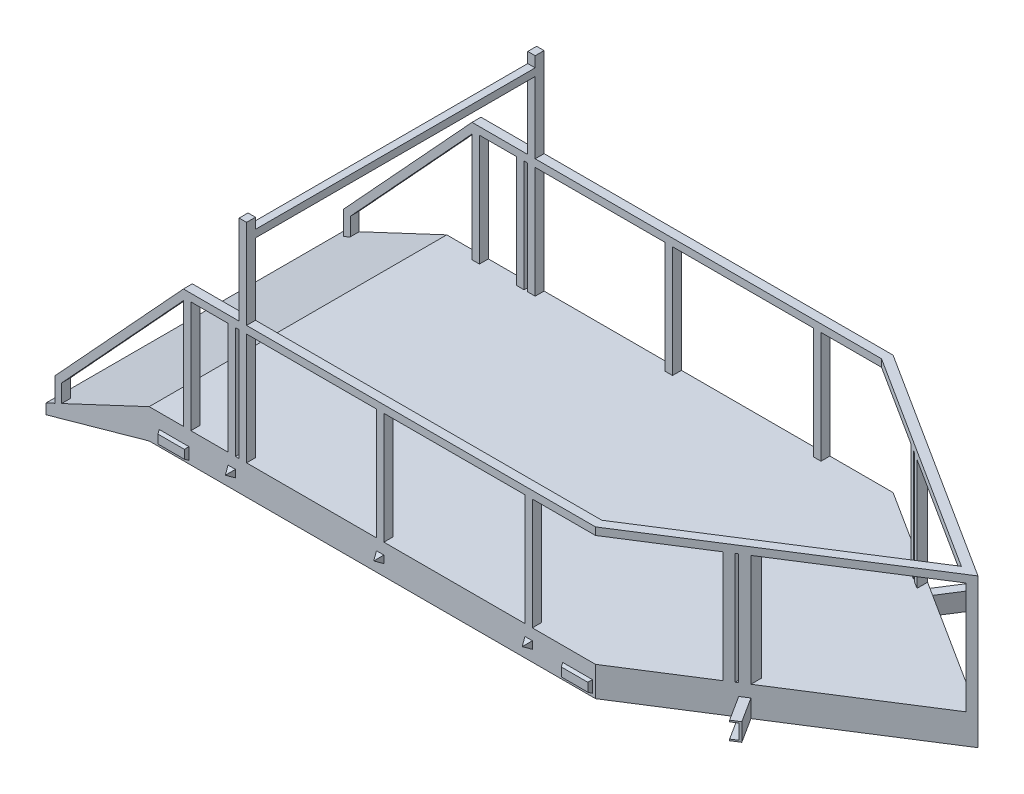
from build123d import *

# Parameters (mm, degrees)
BOSS_EXTRUDE1_DEPTH      = 500
BOSS_EXTRUDE2_DEPTH      = 500
BOSS_EXTRUDE2_DEPTH_BACK = 500
CUT_EXTRUDE1_START       = -500
CUT_EXTRUDE1_OUTLINE_W   = 473.864747831
CUT_EXTRUDE1_OUTLINE_H   = 375
CUT_EXTRUDE1_OUTLINE_W_2 = 7.552750907
CUT_EXTRUDE1_OUTLINE_W_3 = 441.311996924
CUT_EXTRUDE1_OUTLINE_W_4 = 436.609859473
CUT_EXTRUDE1_OUTLINE_W_5 = 473.864747832
CUT_EXTRUDE1_OUTLINE_W_6 = 12.254888358
CUT_EXTRUDE1_OUTLINE_W_7 = 125
CUT_EXTRUDE1_DEPTH       = 1000
BOSS_EXTRUDE3_DEPTH      = 100
CUT_EXTRUDE4_DEPTH       = 470
BOSS_EXTRUDE5_DEPTH      = 500
BOSS_EXTRUDE5_DEPTH_BACK = 500
CUT_EXTRUDE7_DEPTH       = 470
SKETCH10_W               = 1000
SKETCH10_H               = 25
BOSS_EXTRUDE6_DEPTH      = 25
SKETCH11_W               = 25
SKETCH11_H               = 25
SKETCH11_W_2             = 24.921787331
BOSS_EXTRUDE7_DEPTH      = 25
BOSS_EXTRUDE7_TAPER      = 30
BOSS_EXTRUDE8_START      = 525.229495663
BOSS_EXTRUDE8_DEPTH      = 0.022340747
BOSS_EXTRUDE8_START_2    = -485
BOSS_EXTRUDE8_2_DEPTH    = 25
BOSS_EXTRUDE8_START_3    = 13.864747831
BOSS_EXTRUDE8_3_DEPTH    = 25
BOSS_EXTRUDE8_START_4    = 512.729495663
BOSS_EXTRUDE8_4_DEPTH    = 25.022340747
BOSS_EXTRUDE8_START_5    = 37
BOSS_EXTRUDE8_5_DEPTH    = 26
BOSS_EXTRUDE10_DEPTH     = 500
CUT_EXTRUDE8_DEPTH       = 440
CUT_EXTRUDE9_DEPTH       = 23
CUT_EXTRUDE10_DEPTH      = 23
SKETCH20_W               = 100
SKETCH20_H               = 40
BOSS_EXTRUDE11_DEPTH     = 10
BOSS_EXTRUDE11_TAPER     = 29
SKETCH22_W               = 100
SKETCH22_H               = 40
BOSS_EXTRUDE12_DEPTH     = 10
BOSS_EXTRUDE12_TAPER     = 29


with BuildPart() as part:
    # Sketch3 → Boss-Extrude1 (new body)
    with BuildSketch(Plane(origin=(0, 0, 0), x_dir=(1, 0, 0), z_dir=(0, 1, 0))):
        Polygon((750, -500), (1535.458991325, 0), (750, 500), (-750, 500), (-750, -500), align=None)
        Polygon((741.261584038, -470), (1479.593035884, 0), (741.261584038, 470), (-720, 470), (-720, -470), align=None, mode=Mode.SUBTRACT)
    extrude(amount=BOSS_EXTRUDE1_DEPTH)

    # Sketch4 → Boss-Extrude2 (add, two sides: drawn at the far end of the back side and taken through both)
    with BuildSketch(Plane.XY.offset(-BOSS_EXTRUDE2_DEPTH_BACK)):
        Polygon((-750, 0), (-750, 100), (-1044.23243351, -38.029978885), (-1044.23243351, 21.970021115), (-635, 466.05675301), (-635, 500), (-1066.865697626, 31.352330432), (-1066.865697626, -48.647669568), (-1096.782201963, -62.68206548), (-1096.782201963, -97.017235637), align=None)
    extrude(amount=BOSS_EXTRUDE2_DEPTH + BOSS_EXTRUDE2_DEPTH_BACK)

    # Cut-Extrude1: read off the stored shape, not the designer's step
    # Cut-Extrude1 outline → Cut-Extrude1 (cut)
    with BuildSketch(Plane.XY.offset(CUT_EXTRUDE1_START)):
        Polygon((-635, 100), (-635, 466.05675301), (-750, 341.262210872), (-750, 100), align=None)
        with Locations((774.661869579, 287.5)):
            Rectangle(CUT_EXTRUDE1_OUTLINE_W, CUT_EXTRUDE1_OUTLINE_H)
        with Locations((1040.370618948, 287.5)):
            Rectangle(CUT_EXTRUDE1_OUTLINE_W_2, CUT_EXTRUDE1_OUTLINE_H)
        with Locations((1289.802992863, 287.5)):
            Rectangle(CUT_EXTRUDE1_OUTLINE_W_3, CUT_EXTRUDE1_OUTLINE_H)
        with Locations((-204.440181906, 287.5)):
            Rectangle(CUT_EXTRUDE1_OUTLINE_W_4, CUT_EXTRUDE1_OUTLINE_H)
        with Locations((275.797121747, 287.5)):
            Rectangle(CUT_EXTRUDE1_OUTLINE_W_5, CUT_EXTRUDE1_OUTLINE_H)
        with Locations((-453.872555821, 287.5)):
            Rectangle(CUT_EXTRUDE1_OUTLINE_W_6, CUT_EXTRUDE1_OUTLINE_H)
        with Locations((-547.5, 287.5)):
            Rectangle(CUT_EXTRUDE1_OUTLINE_W_7, CUT_EXTRUDE1_OUTLINE_H)
        Polygon((-750, 375.205457862), (-635, 500), (-750, 500), align=None)
    extrude(amount=CUT_EXTRUDE1_DEPTH, mode=Mode.SUBTRACT)

    # Sketch3<6> → Boss-Extrude3 (add)
    with BuildSketch(Plane(origin=(0, 0, 0), x_dir=(1, 0, 0), z_dir=(0, 1, 0))):
        Polygon((750, -500), (1535.458991325, 0), (750, 500), (-750, 500), (-750, -500), align=None)
    extrude(amount=BOSS_EXTRUDE3_DEPTH)

    # Sketch4<6> → Cut-Extrude4 (cut, symmetric)
    with BuildSketch(Plane.XY):
        Polygon((-1066.865697626, -48.647669568), (-1044.23243351, -38.029978885), (-1044.23243351, 21.970021115), (-750, 341.262210872), (-635, 466.05675301), (-635, 500), (-750, 375.205457862), (-1066.865697626, 31.352330432), align=None)
    extrude(amount=CUT_EXTRUDE4_DEPTH, both=True, mode=Mode.SUBTRACT)

    # Sketch4<7> → Boss-Extrude5 (add, two sides: drawn at the far end of the back side and taken through both)
    with BuildSketch(Plane.XY.offset(-BOSS_EXTRUDE5_DEPTH_BACK)):
        Polygon((-447.745111642, 475), (-447.745111642, 100), (-422.745111642, 100), (-422.745111642, 475), (-422.745111642, 500), (-422.745111642, 800), (-447.745111642, 800), (-447.745111642, 500), align=None)
    extrude(amount=BOSS_EXTRUDE5_DEPTH + BOSS_EXTRUDE5_DEPTH_BACK)

    # Sketch4<8> → Cut-Extrude7 (cut, symmetric)
    with BuildSketch(Plane.XY):
        Polygon((-447.745111642, 475), (-447.745111642, 100), (-422.745111642, 100), (-422.745111642, 475), (-422.745111642, 500), (-422.745111642, 800), (-447.745111642, 800), (-447.745111642, 500), align=None)
    extrude(amount=CUT_EXTRUDE7_DEPTH, both=True, mode=Mode.SUBTRACT)

    # Sketch10 → Boss-Extrude6 (add)
    with BuildSketch(Plane.ZY.offset(447.745111642)):
        with Locations((0, 752.218873566)):
            Rectangle(SKETCH10_W, SKETCH10_H)
    extrude(amount=-BOSS_EXTRUDE6_DEPTH)

    # Sketch11 → Boss-Extrude7 (add)
    with BuildSketch(Plane.XY.offset(500)):
        with Locations((525.229495663, 50)):
            Rectangle(SKETCH11_W, SKETCH11_H)
        with Locations((26.364747831, 50)):
            Rectangle(SKETCH11_W, SKETCH11_H)
        with Locations((-472.460893666, 50)):
            Rectangle(SKETCH11_W_2, SKETCH11_H)
    extrude(amount=BOSS_EXTRUDE7_DEPTH, taper=BOSS_EXTRUDE7_TAPER)

    # Boss-Extrude8: read off the stored shape, not the designer's step
    # Boss-Extrude8 outline → Boss-Extrude8 (add)
    with BuildSketch(Plane.YZ.offset(BOSS_EXTRUDE8_START)):
        Polygon((62.5, -500), (37.5, -500), (50, -521.650635095), align=None)
    extrude(amount=BOSS_EXTRUDE8_DEPTH)

    # Boss-Extrude8 2 outline → Boss-Extrude8 2 (add)
    with BuildSketch(Plane.YZ.offset(BOSS_EXTRUDE8_START_2)):
        Polygon((62.5, -500), (37.5, -500), (50, -521.650635095), align=None)
    extrude(amount=BOSS_EXTRUDE8_2_DEPTH)

    # Boss-Extrude8 3 outline → Boss-Extrude8 3 (add)
    with BuildSketch(Plane.YZ.offset(BOSS_EXTRUDE8_START_3)):
        Polygon((62.5, -500), (37.5, -500), (50, -521.650635095), align=None)
    extrude(amount=BOSS_EXTRUDE8_3_DEPTH)

    # Boss-Extrude8 4 outline → Boss-Extrude8 4 (add)
    with BuildSketch(Plane.YZ.offset(BOSS_EXTRUDE8_START_4)):
        Polygon((62.5, -500), (37.5, -500), (50, -521.650635095), align=None)
    extrude(amount=BOSS_EXTRUDE8_4_DEPTH)

    # Boss-Extrude8 5 outline → Boss-Extrude8 5 (cut)
    with BuildSketch(Plane(origin=(0, 0, 0), x_dir=(1, 0, 0), z_dir=(0, 1, 0)).offset(BOSS_EXTRUDE8_START_5)):
        Polygon((512.729495663, 500), (525.229495663, 521.650635095), (525.240666036, 521.669982749), (524.472780219, 523), (512.729495663, 523), align=None)
        Polygon((526.008551854, 523), (525.240666036, 521.669982749), (525.25183641, 521.650635095), (537.75183641, 500), (537.75183641, 523), align=None)
        Polygon((38.864747831, 500), (38.864747831, 523), (13.864747831, 523), (13.864747831, 500), (26.364747831, 521.650635095), align=None)
        Polygon((-460, 500), (-460, 523), (-485, 523), (-485, 500), (-472.5, 521.650635095), align=None)
    extrude(amount=BOSS_EXTRUDE8_5_DEPTH, mode=Mode.SUBTRACT)

    # Sketch15 → Boss-Extrude10 (add)
    with BuildSketch(Plane(origin=(0, 500, 0), x_dir=(1, 0, 0), z_dir=(0, 1, 0))):
        Polygon((1069.146994401, -296.84044748), (1044.146994401, -312.754709253), (1097.846962052, -397.112954104), (1122.846962052, -381.198692331), align=None)
        Polygon((1044.146994401, 312.754709253), (1097.846962052, 397.112954104), (1122.846962052, 381.198692331), (1069.146994401, 296.84044748), align=None)
    extrude(amount=-BOSS_EXTRUDE10_DEPTH)

    # Sketch15<2> → Cut-Extrude8 (cut)
    with BuildSketch(Plane(origin=(0, 500, 0), x_dir=(1, 0, 0), z_dir=(0, 1, 0))):
        Polygon((1069.146994401, -296.84044748), (1044.146994401, -312.754709253), (1097.846962052, -397.112954104), (1122.846962052, -381.198692331), align=None)
        Polygon((1044.146994401, 312.754709253), (1097.846962052, 397.112954104), (1122.846962052, 381.198692331), (1069.146994401, 296.84044748), align=None)
    extrude(amount=-CUT_EXTRUDE8_DEPTH, mode=Mode.SUBTRACT)

    # Sketch17 → Cut-Extrude9 (cut)
    with BuildSketch(Plane(origin=(601.368753994, 0, -382.813590929), x_dir=(0.5369996765096833, 0, 0.8435824485066624), z_dir=(-0.8435824485066624, 0, 0.5369996765096833))):
        Polygon((824.540981636, 5), (919.540981636, 5), (968.552500425, 5), (968.552500425, 55), (924.540981636, 55), (824.540981636, 55), align=None)
    extrude(amount=-CUT_EXTRUDE9_DEPTH, mode=Mode.SUBTRACT)

    # Sketch19 → Cut-Extrude10 (cut)
    with BuildSketch(Plane(origin=(601.368753994, 0, 382.813590929), x_dir=(-0.5369996765096847, 0, 0.8435824485066614), z_dir=(-0.8435824485066615, 0, -0.5369996765096847))):
        Polygon((-829.540981636, 55), (-824.540981636, 55), (-824.540981636, 5), (-829.540981636, 5), (-919.540981636, 5), (-930.414815986, 5), (-930.414815986, 55), (-919.540981636, 55), align=None)
    extrude(amount=-CUT_EXTRUDE10_DEPTH, mode=Mode.SUBTRACT)

    # Sketch20 → Boss-Extrude11 (add)
    with BuildSketch(Plane.XY.offset(500)):
        with Locations((689.590277632, 30.409722368)):
            Rectangle(SKETCH20_W, SKETCH20_H)
    boss_extrude11 = extrude(amount=BOSS_EXTRUDE11_DEPTH, taper=BOSS_EXTRUDE11_TAPER)

    # Mirror1: Boss-Extrude11 across plane
    add(boss_extrude11.mirror(Plane.XY))

    # Sketch22 → Boss-Extrude12 (add)
    with BuildSketch(Plane.XY.offset(500)):
        with Locations((-666.276639524, 30.409722368)):
            Rectangle(SKETCH22_W, SKETCH22_H)
    boss_extrude12 = extrude(amount=BOSS_EXTRUDE12_DEPTH, taper=BOSS_EXTRUDE12_TAPER)

    # Mirror2: Boss-Extrude12 across plane
    add(boss_extrude12.mirror(Plane.XY))


solid = part.part
